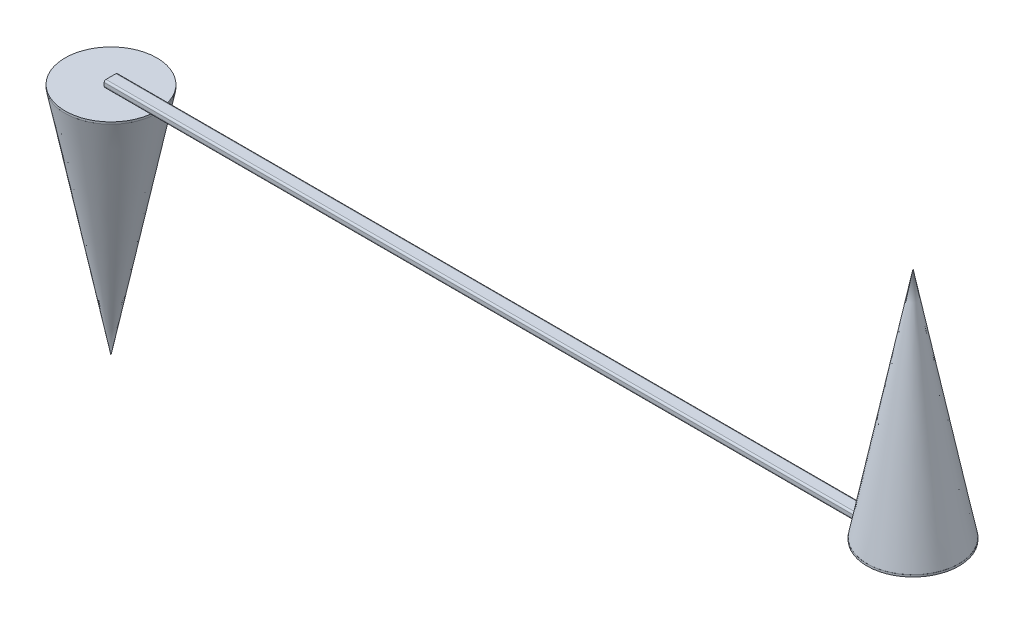
from build123d import *

# Parameters (mm, degrees)
RECTANGULAR_TUBE_50_X_30_X_2_6_1_DEPTH = 1200
BOSS_EXTRUDE1_START                    = 2.8
BOSS_EXTRUDE1_OUTLINE_R                = 68.75
BOSS_EXTRUDE1_DEPTH                    = 3
SKETCH14_R                             = 68.75
BOSS_EXTRUDE2_DEPTH                    = 3


# Read off the part's stored shape, not the designer's step: Boss-Extrude1
with BuildPart() as part:
    # Sketch12 → Rectangular tube 50 X 30 X 2.6(1) (new body)
    with BuildSketch(Plane.YZ.offset(-600)):
        with BuildLine():
            Line((-4.8, 2.2), (0.2, 2.2))
            ThreePointArc((0.2, 2.2), (2.038477631, 2.961522369), (2.8, 4.8))
            Line((2.8, 4.8), (2.8, 19.8))
            ThreePointArc((2.8, 19.8), (2.038477631, 21.638477631), (0.2, 22.4))
            Line((0.2, 22.4), (-4.8, 22.4))
            ThreePointArc((-4.8, 22.4), (-6.638477631, 21.638477631), (-7.4, 19.8))
            Line((-7.4, 19.8), (-7.4, 4.8))
            ThreePointArc((-7.4, 4.8), (-6.638477631, 2.961522369), (-4.8, 2.2))
        make_face()
    extrude(amount=RECTANGULAR_TUBE_50_X_30_X_2_6_1_DEPTH)


with BuildPart() as body_2:
    # Boss-Extrude1 outline → Boss-Extrude1 (new body)
    with BuildSketch(Plane(origin=(0, 0, 0), x_dir=(1, 0, 0), z_dir=(0, 1, 0)).offset(BOSS_EXTRUDE1_START)):
        with Locations((600, -12.3)):
            Circle(BOSS_EXTRUDE1_OUTLINE_R)
    extrude(amount=BOSS_EXTRUDE1_DEPTH)


with BuildPart() as body_3:
    # Sketch14 → Boss-Extrude2 (new body)
    with BuildSketch(Plane.XZ.offset(7.4)):
        with Locations(Location((-600, 12.3, 0), (0, 0, 270))):
            Circle(SKETCH14_R)
    extrude(amount=BOSS_EXTRUDE2_DEPTH)


with BuildPart() as body_4:
    # Sketch17 → Revolve17 (revolve)
    with BuildSketch(Plane(origin=(600, 0, 0), x_dir=(0, 0, -1), z_dir=(1, 0, 0))):
        Polygon((-12.3, 353.8), (56.312332664, 5.8), (52.312332664, 5.8), (-12.3, 333.121537742), align=None)
    revolve(axis=Axis((600, 5.8, 12.3), (0, 1, 0)))


with BuildPart() as body_5:
    # Sketch20 → Revolve23 (revolve)
    with BuildSketch(Plane(origin=(-600, 0, 0), x_dir=(0, 0, -1), z_dir=(1, 0, 0))):
        Polygon((-81.05, -10.4), (-12.3, -358.4), (-12.3, -337.761394115), (-77.05, -10.4), align=None)
    revolve(axis=Axis((-600, -10.4, 12.3), (0, -1, 0)))


solid = Compound([part.part, body_2.part, body_3.part, body_4.part, body_5.part])
